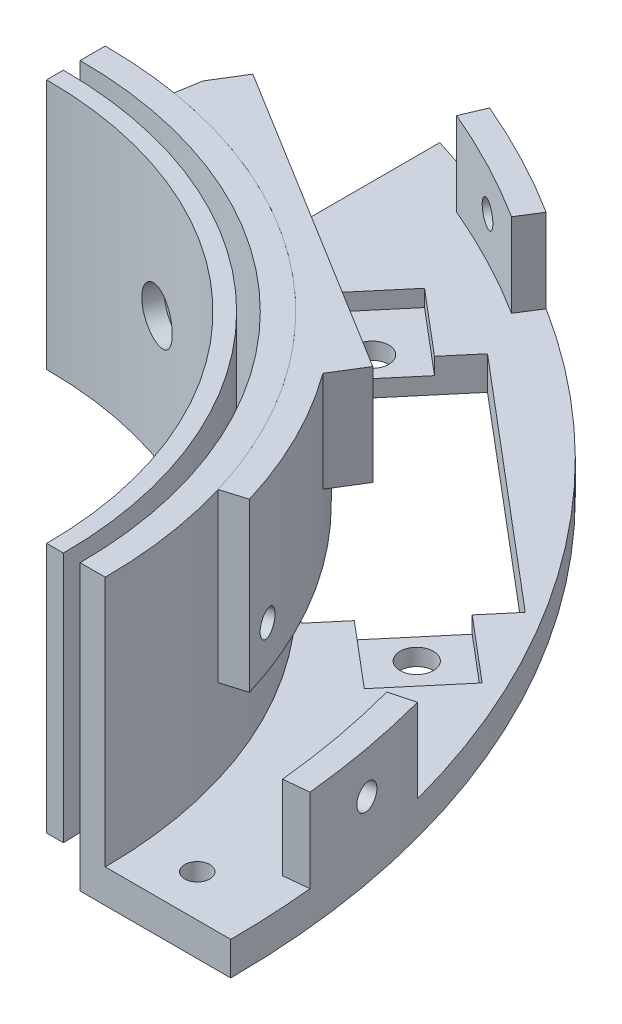
from build123d import *

# Parameters (mm, degrees)
BOSS_EXTRUDE1_DEPTH                  = 15
BOSS_EXTRUDE3_DEPTH                  = 15
BOSS_EXTRUDE4_START                  = -1
BOSS_EXTRUDE4_OUTLINE_R              = 3.9
BOSS_EXTRUDE4_DEPTH                  = 3.000000045
BOSS_EXTRUDE4_START_2                = -5
BOSS_EXTRUDE4_2_DEPTH                = 10
BOSS_EXTRUDE5_REACH                  = 64.086
BOSS_EXTRUDE5_END_RADIUS             = 52
SKETCH4_R                            = 5.6
BOSS_EXTRUDE5_DIRECTION_2_REACH      = 64.086
BOSS_EXTRUDE5_DIRECTION_2_END_RADIUS = 50
CUT_EXTRUDE1_DEPTH                   = 63.507756445
CUT_EXTRUDE1_DEPTH_BACK              = 63.507756445
SKETCH5_R                            = 1.5
SKETCH6_R                            = 3
CUT_EXTRUDE2_DEPTH                   = 63.507756445
CUT_EXTRUDE3_DEPTH                   = 63.086276891
CUT_EXTRUDE3_DEPTH_BACK              = 63.086276891
SKETCH7_R                            = 1.5
SKETCH8_R                            = 3
CUT_EXTRUDE4_DEPTH                   = 63.086276891
BOSS_EXTRUDE6_START                  = -4
BOSS_EXTRUDE6_DEPTH                  = 4
CUT_EXTRUDE5_DEPTH                   = 34
SKETCH12_R                           = 2
SKETCH12_R_2                         = 1.5
CUT_EXTRUDE6_DEPTH                   = 92.433035695
CUT_EXTRUDE7_DEPTH                   = 2
SKETCH15_R                           = 1.5
CUT_EXTRUDE8_DEPTH                   = 75.092800808
SKETCH17_R                           = 1.5
CUT_EXTRUDE9_DEPTH                   = 93.802532143
BOSS_EXTRUDE7_DEPTH                  = 10
CUT_EXTRUDE10_REACH                  = 106.962
CUT_EXTRUDE10_END_RADIUS             = 96.464285714
SKETCH21_R                           = 1.5
CUT_EXTRUDE11_REACH                  = 106.962
CUT_EXTRUDE11_END_RADIUS             = 96.464285714
SKETCH22_R                           = 1.5
BOSS_EXTRUDE8_DEPTH                  = 20
CUT_EXTRUDE12_REACH                  = 76.093
CUT_EXTRUDE12_END_RADIUS             = 58
SKETCH24_R                           = 1.5
CUT_EXTRUDE13_REACH                  = 94.803
CUT_EXTRUDE13_END_RADIUS             = 58
SKETCH25_R                           = 1.5
BOSS_EXTRUDE9_DEPTH                  = 12
SKETCH28_R                           = 1
CUT_EXTRUDE14_DEPTH                  = 90.439608754
CUT_EXTRUDE15_REACH                  = 93.44
CUT_EXTRUDE15_END_RADIUS             = 55
CUT_EXTRUDE15_START                  = -2
SKETCH29_R                           = 2.5


with BuildPart() as part:
    # Sketch1 → Boss-Extrude1 (new, symmetric)
    with BuildSketch(Plane(origin=(0, 0, 0), x_dir=(1, 0, 0), z_dir=(0, 1, 0))):
        with BuildLine():
            Line((0, 0), (0, 2))
            ThreePointArc((0, 2), (35.355339059, -12.644660941), (50, -48))
            Line((50, -48), (48, -48))
            ThreePointArc((48, -48), (33.941125497, -14.058874503), (0, 0))
        make_face()
    extrude(amount=BOSS_EXTRUDE1_DEPTH, both=True)

    # Boss-Extrude4: read off the stored shape, not the designer's step
    # Boss-Extrude4 outline → Boss-Extrude4 (add)
    with BuildSketch(Plane(origin=(16.75254906, 0, 0.89), x_dir=(-0.9422000000000001, 0, -0.3350509811953995), z_dir=(0.3350509811953995, 0, -0.9422000000000001)).offset(BOSS_EXTRUDE4_START)):
        Circle(BOSS_EXTRUDE4_OUTLINE_R)
    extrude(amount=BOSS_EXTRUDE4_DEPTH)

    # Boss-Extrude4 2 outline → Boss-Extrude4 2 (cut)
    with BuildSketch(Plane(origin=(0, 0, 0), x_dir=(1, 0, 0), z_dir=(0, 1, 0)).offset(BOSS_EXTRUDE4_START_2)):
        with BuildLine():
            Line((13, 2.353981715), (13.697961257, 2.163391606))
            ThreePointArc((13.697961257, 2.163391606), (15.571280365, 1.613861246), (17.422651638, 0.99439978))
            Line((17.422651638, 0.99439978), (13.748071037, 2.301098869))
            Line((13.748071037, 2.301098869), (13, 2.567116631))
            Line((13, 2.567116631), (13, 2.353981715))
        make_face()
        with BuildLine():
            Line((21.097231037, -0.312298784), (17.422651638, 0.99439978))
            ThreePointArc((17.422651638, 0.99439978), (19.248965557, 0.306079585), (21.048162872, -0.450290856))
            Line((21.048162872, -0.450290856), (22, -0.871627248))
            Line((22, -0.871627248), (22, -0.633327893))
            Line((22, -0.633327893), (21.097231037, -0.312298784))
        make_face()
    extrude(amount=BOSS_EXTRUDE4_2_DEPTH, mode=Mode.SUBTRACT)

    # Boss-Extrude5: up to this cylinder (the profile starts inside it)
    boss_extrude5_end = Plane(origin=(0, 0, 48), z_dir=(0, -1, 0)) * Cylinder(BOSS_EXTRUDE5_END_RADIUS, 233.172, mode=Mode.PRIVATE)
    # Sketch4 → Boss-Extrude5 (add, up to the surface)
    with BuildSketch(Plane(origin=(46.9375, 0, 30.770052416), x_dir=(-0.34459895168151616, 0, -0.9387500000000002), z_dir=(0.9387500000000002, 0, -0.34459895168151616)), mode=Mode.PRIVATE) as boss_extrude5_sk1:
        with Locations(Location((0, 0, 0), (0, 0, 180))):
            Circle(SKETCH4_R)
    boss_extrude5_tool1 = extrude(boss_extrude5_sk1.sketch, amount=BOSS_EXTRUDE5_REACH, mode=Mode.PRIVATE) & boss_extrude5_end
    add(boss_extrude5_tool1.solids().sort_by_distance((46.9375, 0, 30.770052))[0])

    # Boss-Extrude5 direction 2: up to this cylinder (the profile starts outside it)
    boss_extrude5_direction_2_end = Plane(origin=(0, 0, 48), z_dir=(0, -1, 0)) * Cylinder(BOSS_EXTRUDE5_DIRECTION_2_END_RADIUS, 229.172, mode=Mode.PRIVATE)
    # Sketch4 → Boss-Extrude5 direction 2 (add, up to the surface)
    with BuildSketch(Plane(origin=(46.9375, 0, 30.770052416), x_dir=(-0.34459895168151616, 0, -0.9387500000000002), z_dir=(0.9387500000000002, 0, -0.34459895168151616)), mode=Mode.PRIVATE) as boss_extrude5_direction_2_sk1:
        with Locations(Location((0, 0, 0), (0, 0, 180))):
            Circle(SKETCH4_R)
    boss_extrude5_direction_2_tool1 = extrude(boss_extrude5_direction_2_sk1.sketch, amount=-BOSS_EXTRUDE5_DIRECTION_2_REACH, mode=Mode.PRIVATE) - boss_extrude5_direction_2_end
    add(boss_extrude5_direction_2_tool1.solids().sort_by_distance((46.9375, 0, 30.770052))[0])
    add(boss_extrude5_direction_2_tool1.solids().sort_by_distance((46.9375, 0, 30.770052))[1])

    # Sketch5 → Cut-Extrude1 (cut, two sides: drawn at the far end of the back side and taken through both)
    with BuildSketch(Plane(origin=(16.75254906, 0, 0.89), x_dir=(-0.9422000000000001, 0, -0.3350509811953995), z_dir=(0.3350509811953995, 0, -0.9422000000000001)).offset(-CUT_EXTRUDE1_DEPTH_BACK)):
        Circle(SKETCH5_R)
    extrude(amount=CUT_EXTRUDE1_DEPTH + CUT_EXTRUDE1_DEPTH_BACK, mode=Mode.SUBTRACT)

    # Sketch6 → Cut-Extrude2 (cut, through all)
    with BuildSketch(Plane(origin=(16.75254906, 0, 0.89), x_dir=(-0.9422000000000001, 0, -0.3350509811953995), z_dir=(0.3350509811953995, 0, -0.9422000000000001))):
        Circle(SKETCH6_R)
    extrude(amount=-CUT_EXTRUDE2_DEPTH, mode=Mode.SUBTRACT)

    # Sketch7 → Cut-Extrude3 (cut, two sides: drawn at the far end of the back side and taken through both)
    with BuildSketch(Plane(origin=(46.9375, 0, 30.770052416), x_dir=(-0.34459895168151616, 0, -0.9387500000000002), z_dir=(0.9387500000000002, 0, -0.34459895168151616)).offset(-CUT_EXTRUDE3_DEPTH_BACK)):
        Circle(SKETCH7_R)
    extrude(amount=CUT_EXTRUDE3_DEPTH + CUT_EXTRUDE3_DEPTH_BACK, mode=Mode.SUBTRACT)

    # Sketch8 → Cut-Extrude4 (cut, through all)
    with BuildSketch(Plane(origin=(46.9375, 0, 30.770052416), x_dir=(-0.34459895168151616, 0, -0.9387500000000002), z_dir=(0.9387500000000002, 0, -0.34459895168151616))):
        Circle(SKETCH8_R)
    extrude(amount=-CUT_EXTRUDE4_DEPTH, mode=Mode.SUBTRACT)


with BuildPart() as body_2:
    # Sketch3 → Boss-Extrude3 (new, symmetric)
    with BuildSketch(Plane(origin=(0, 0, 0), x_dir=(1, 0, 0), z_dir=(0, 1, 0))):
        with BuildLine():
            Line((0, 4), (0, 7))
            ThreePointArc((0, 7), (38.890872965, -9.109127035), (55, -48))
            Line((55, -48), (52, -48))
            ThreePointArc((52, -48), (36.769552622, -11.230447378), (0, 4))
        make_face()
    extrude(amount=BOSS_EXTRUDE3_DEPTH, both=True)

    # Sketch9 → Boss-Extrude6 (add)
    with BuildSketch(Plane(origin=(0, -15, 0), x_dir=(1, 0, 0), z_dir=(0, 1, 0)).offset(BOSS_EXTRUDE6_START)):
        with BuildLine():
            Line((0, 4), (0, 47))
            ThreePointArc((0, 47), (50.610018108, 11.002118606), (70, -48))
            Line((70, -48), (52, -48))
            ThreePointArc((52, -48), (36.769552622, -11.230447378), (0, 4))
        make_face()
    extrude(amount=BOSS_EXTRUDE6_DEPTH)

    # Sketch10 → Cut-Extrude5 (cut)
    with BuildSketch(Plane(origin=(0, 15, 0), x_dir=(1, 0, 0), z_dir=(0, 1, 0))):
        Polygon((12.45520362, 13.472497125), (41.486156545, -11.046959889), (53.745885052, 3.468516574), (24.714932127, 27.987973588), align=None)
    extrude(amount=-CUT_EXTRUDE5_DEPTH, mode=Mode.SUBTRACT)

    # Sketch12 → Cut-Extrude6 (cut, through all)
    with BuildSketch(Plane(origin=(0, -19, 0), x_dir=(1, 0, 0), z_dir=(0, 1, 0))):
        with Locations(Location((15.911164314, 22.988606397, 0), (0, 0, 90))):
            Circle(SKETCH12_R)
        with Locations(Location((50.289924358, -6.047592698, 0), (0, 0, 90))):
            Circle(SKETCH12_R)
        with Locations(Location((5, 25.5, 0), (0, 0, 90))):
            Circle(SKETCH12_R_2)
        with Locations(Location((61, -43, 0), (0, 0, 90))):
            Circle(SKETCH12_R_2)
    extrude(amount=CUT_EXTRUDE6_DEPTH, mode=Mode.SUBTRACT)

    # Sketch13 → Cut-Extrude7 (cut)
    with BuildSketch(Plane.XZ.offset(15)):
        Polygon((15.358823529, -16.910373129), (7.719099075, -23.362861817), (14.171587763, -31.002586271), (21.811312217, -24.550097583), align=None)
        Polygon((58.481989597, 6.421848118), (50.842265143, -0.03064057), (44.389776455, 7.609083884), (52.029500909, 14.061572572), align=None)
    extrude(amount=CUT_EXTRUDE7_DEPTH, mode=Mode.SUBTRACT)

    # Sketch15 → Cut-Extrude8 (cut, through all)
    with BuildSketch(Plane(origin=(16.75254906, 0, 0.89), x_dir=(-0.9422000000000001, 0, -0.3350509811953995), z_dir=(0.3350509811953995, 0, -0.9422000000000001))):
        with Locations(Location((0, 0, 0), (0, 0, 180))):
            Circle(SKETCH15_R)
    extrude(amount=CUT_EXTRUDE8_DEPTH, mode=Mode.SUBTRACT)

    # Sketch17 → Cut-Extrude9 (cut, through all)
    with BuildSketch(Plane(origin=(46.9375, 0, 30.770052416), x_dir=(-0.34459895168151616, 0, -0.9387500000000002), z_dir=(0.9387500000000002, 0, -0.34459895168151616))):
        with Locations(Location((0, 0, 0), (0, 0, 180))):
            Circle(SKETCH17_R)
    extrude(amount=CUT_EXTRUDE9_DEPTH, mode=Mode.SUBTRACT)

    # Sketch19 → Boss-Extrude7 (add)
    with BuildSketch(Plane.XZ.offset(15)):
        with BuildLine():
            Line((69.497307002, 38.012643005), (66.512469017, 38.313877471))
            ThreePointArc((66.512469017, 38.313877471), (65.422459077, 30.625763866), (63.717618824, 23.050228757))
            Line((63.717618824, 23.050228757), (66.615538106, 22.274301033))
            ThreePointArc((66.615538106, 22.274301033), (68.373398197, 30.085432198), (69.497307002, 38.012643005))
        make_face()
        with BuildLine():
            Line((8.218266739, -40.799682764), (9.390178773, -43.561316734))
            ThreePointArc((9.390178773, -43.561316734), (16.628654889, -40.139576577), (23.568466137, -36.146725211))
            Line((23.568466137, -36.146725211), (21.968914555, -33.608727036))
            ThreePointArc((21.968914555, -33.608727036), (15.238418979, -37.481147696), (8.218266739, -40.799682764))
        make_face()
    extrude(amount=-BOSS_EXTRUDE7_DEPTH)

    # Cut-Extrude10: up to this cylinder (the profile starts outside it)
    cut_extrude10_end = Plane(origin=(-29.464285714, -10, 48), z_dir=(0, -1, 0)) * Cylinder(CUT_EXTRUDE10_END_RADIUS, 407.852571429, mode=Mode.PRIVATE)
    # Sketch21 → Cut-Extrude10 (cut, up to the surface)
    with BuildSketch(Plane(origin=(16.628654889, -5, -40.139576577), x_dir=(-0.8861429602003462, 0, -0.463411970159779), z_dir=(0.463411970159779, 0, -0.8861429602003462)), mode=Mode.PRIVATE) as cut_extrude10_sk1:
        with Locations((0, -5)):
            Circle(SKETCH21_R)
    cut_extrude10_tool1 = extrude(cut_extrude10_sk1.sketch, amount=-CUT_EXTRUDE10_REACH, mode=Mode.PRIVATE) - cut_extrude10_end
    add(cut_extrude10_tool1.solids().sort_by_distance((16.628655, -10, -40.139577))[0], mode=Mode.SUBTRACT)

    # Cut-Extrude11: up to this cylinder (the profile starts outside it)
    cut_extrude11_end = Plane(origin=(-29.464285714, -10, 48), z_dir=(0, -1, 0)) * Cylinder(CUT_EXTRUDE11_END_RADIUS, 407.852571429, mode=Mode.PRIVATE)
    # Sketch22 → Cut-Extrude11 (cut, up to the surface)
    with BuildSketch(Plane(origin=(68.373398197, -5, 30.085432198), x_dir=(-0.18011055599990136, 0, -0.9836463732548434), z_dir=(0.9836463732548434, 0, -0.18011055599990136)), mode=Mode.PRIVATE) as cut_extrude11_sk1:
        with Locations((0, -5)):
            Circle(SKETCH22_R)
    cut_extrude11_tool1 = extrude(cut_extrude11_sk1.sketch, amount=-CUT_EXTRUDE11_REACH, mode=Mode.PRIVATE) - cut_extrude11_end
    add(cut_extrude11_tool1.solids().sort_by_distance((68.373398, -10, 30.085432))[0], mode=Mode.SUBTRACT)


with BuildPart() as body_3:
    # Sketch23 → Boss-Extrude8 (new body)
    with BuildSketch(Plane(origin=(0, 15, 0), x_dir=(1, 0, 0), z_dir=(0, 1, 0))):
        with BuildLine():
            Line((8.96982545, 6.263636364), (9.459088656, 9.223471074))
            ThreePointArc((9.459088656, 9.223471074), (38.302511734, -4.446382528), (55.545785124, -31.306715273))
            Line((55.545785124, -31.306715273), (52.672727273, -32.170161035))
            ThreePointArc((52.672727273, -32.170161035), (36.321347334, -6.699155846), (8.96982545, 6.263636364))
        make_face()
    extrude(amount=-BOSS_EXTRUDE8_DEPTH)

    # Cut-Extrude12: up to this cylinder (the profile starts inside it)
    cut_extrude12_end = Plane(origin=(0, 0, 48), z_dir=(0, 1, 0)) * Cylinder(CUT_EXTRUDE12_END_RADIUS, 269.186, mode=Mode.PRIVATE)
    # Sketch24 → Cut-Extrude12 (cut, up to the surface)
    with BuildSketch(Plane(origin=(16.75254906, 0, 0.89), x_dir=(-0.9422000000000001, 0, -0.3350509811953995), z_dir=(0.3350509811953995, 0, -0.9422000000000001)), mode=Mode.PRIVATE) as cut_extrude12_sk1:
        with Locations(Location((0, 0, 0), (0, 0, 180))):
            Circle(SKETCH24_R)
    cut_extrude12_tool1 = extrude(cut_extrude12_sk1.sketch, amount=CUT_EXTRUDE12_REACH, mode=Mode.PRIVATE) & cut_extrude12_end
    add(cut_extrude12_tool1.solids().sort_by_distance((16.752549, 0, 0.89))[0], mode=Mode.SUBTRACT)

    # Cut-Extrude13: up to this cylinder (the profile starts inside it)
    cut_extrude13_end = Plane(origin=(0, 0, 48), z_dir=(0, 1, 0)) * Cylinder(CUT_EXTRUDE13_END_RADIUS, 306.606, mode=Mode.PRIVATE)
    # Sketch25 → Cut-Extrude13 (cut, up to the surface)
    with BuildSketch(Plane(origin=(46.9375, 0, 30.770052416), x_dir=(-0.34459895168151616, 0, -0.9387500000000002), z_dir=(0.9387500000000002, 0, -0.34459895168151616)), mode=Mode.PRIVATE) as cut_extrude13_sk1:
        with Locations(Location((0, 0, 0), (0, 0, 180))):
            Circle(SKETCH25_R)
    cut_extrude13_tool1 = extrude(cut_extrude13_sk1.sketch, amount=CUT_EXTRUDE13_REACH, mode=Mode.PRIVATE) & cut_extrude13_end
    add(cut_extrude13_tool1.solids().sort_by_distance((46.9375, 0, 30.770052))[0], mode=Mode.SUBTRACT)

    # Sketch26 → Boss-Extrude9 (add)
    with BuildSketch(Plane(origin=(0, 15, 0), x_dir=(1, 0, 0), z_dir=(0, 1, 0))):
        with BuildLine():
            Line((49.180117065, -10.193703097), (30.457660935, 1.359202692))
            ThreePointArc((30.457660935, 1.359202692), (39.424394073, -5.459229532), (46.904001082, -13.882340606))
            Line((46.904001082, -13.882340606), (49.180117065, -10.193703097))
        make_face()
        with BuildLine():
            Line((30.457660935, 1.359202692), (11.735204639, 12.912108584))
            Line((11.735204639, 12.912108584), (9.459088656, 9.223471074))
            ThreePointArc((9.459088656, 9.223471074), (20.342035389, 6.315758268), (30.457660935, 1.359202692))
        make_face()
    extrude(amount=-BOSS_EXTRUDE9_DEPTH)

    # Sketch28 → Cut-Extrude14 (cut, through all)
    with BuildSketch(Plane(origin=(9.006542796, 0, -14.595860597), x_dir=(-0.8510207369531109, 0, -0.5251320836473278), z_dir=(0.5251320836473278, 0, -0.8510207369531109))):
        with Locations((-41.456340015, 7)):
            Circle(SKETCH28_R)
        with Locations((-8.956340015, 7)):
            Circle(SKETCH28_R)
    extrude(amount=-CUT_EXTRUDE14_DEPTH, mode=Mode.SUBTRACT)

    # Cut-Extrude15: up to this cylinder (the profile starts outside it)
    cut_extrude15_end = Plane(origin=(0, 7, 48), z_dir=(0, 1, 0)) * Cylinder(CUT_EXTRUDE15_END_RADIUS, 297.88, mode=Mode.PRIVATE)
    # Sketch29 → Cut-Extrude15 (cut, up to the surface)
    with BuildSketch(Plane(origin=(9.006542796, 0, -14.595860597), x_dir=(-0.851020736953111, 0, -0.5251320836473279), z_dir=(0.5251320836473279, 0, -0.851020736953111)).offset(CUT_EXTRUDE15_START), mode=Mode.PRIVATE) as cut_extrude15_sk1:
        with Locations((-41.456340015, 7)):
            Circle(SKETCH29_R)
    cut_extrude15_tool1 = extrude(cut_extrude15_sk1.sketch, amount=-CUT_EXTRUDE15_REACH, mode=Mode.PRIVATE) - cut_extrude15_end
    add(cut_extrude15_tool1.solids().sort_by_distance((43.236484, 7, 8.876235))[0], mode=Mode.SUBTRACT)
    # Sketch29 → Cut-Extrude15 (cut, up to the surface)
    with BuildSketch(Plane(origin=(9.006542796, 0, -14.595860597), x_dir=(-0.851020736953111, 0, -0.5251320836473279), z_dir=(0.5251320836473279, 0, -0.851020736953111)).offset(CUT_EXTRUDE15_START), mode=Mode.PRIVATE) as cut_extrude15_sk2:
        with Locations((-8.956340015, 7)):
            Circle(SKETCH29_R)
    cut_extrude15_tool2 = extrude(cut_extrude15_sk2.sketch, amount=-CUT_EXTRUDE15_REACH, mode=Mode.PRIVATE) - cut_extrude15_end
    add(cut_extrude15_tool2.solids().sort_by_distance((15.57831, 7, -8.190558))[0], mode=Mode.SUBTRACT)


solid = Compound([part.part, body_2.part, body_3.part])
